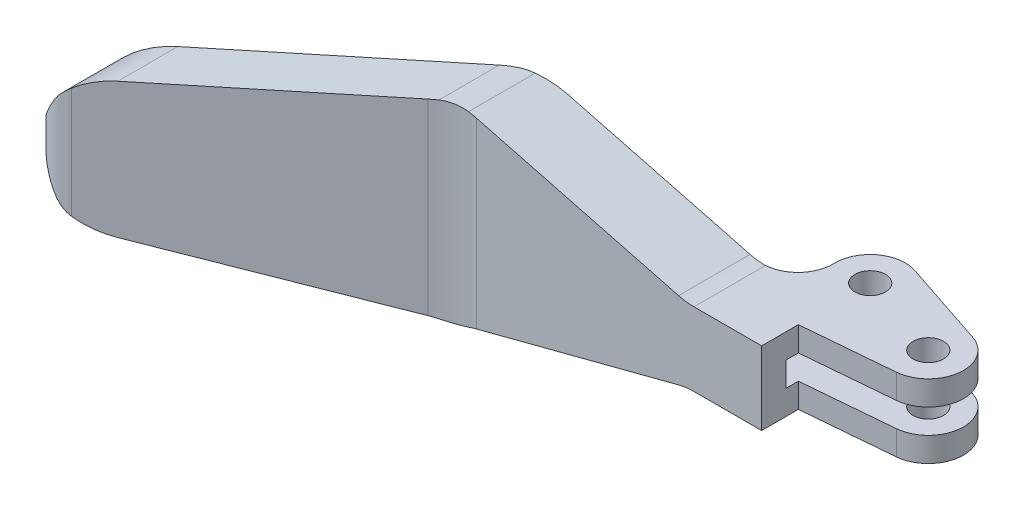
from build123d import *

# Parameters (mm, degrees)
SKETCH2_R               = 1.27
BOSS_EXTRUDE1_DEPTH     = 16.002
CUT_EXTRUDE1_DEPTH      = 60.496550351
CUT_EXTRUDE1_DEPTH_BACK = 60.496550351
SKETCH3_W               = 12.7
SKETCH3_H               = 2.032
FILLET1_R               = 5.08
SKETCH4_W               = 9.906
SKETCH4_H               = 2.032
CUT_EXTRUDE2_DEPTH      = 55.596199244


with BuildPart() as part:
    # Sketch2 → Boss-Extrude1 (new body)
    with BuildSketch(Plane(origin=(0, 0, 0), x_dir=(1, 0, 0), z_dir=(0, 1, 0))):
        with BuildLine():
            Line((-6.309150324, 5.176027743), (0.921622127, 2.771796106))
            ThreePointArc((0.921622127, 2.771796106), (2.901075357, -0.340591799), (0.254581925, -2.909884713))
            Line((0.254581925, -2.909884713), (-7.230772451, -3.564768363))
            Line((-7.230772451, -3.564768363), (-7.230772451, -6.612768363))
            Line((-7.230772451, -6.612768363), (-30.929295079, -6.612768363))
            ThreePointArc((-30.929295079, -6.612768363), (-32.572796015, -6.829139367), (-34.104295079, -7.463507049))
            Line((-34.104295079, -7.463507049), (-52.868054087, -18.296768363))
            ThreePointArc((-52.868054087, -18.296768363), (-54.409974386, -18.499766022), (-55.643817707, -17.553004743))
            Line((-55.643817707, -17.553004743), (-55.770817707, -17.33303429))
            ThreePointArc((-55.770817707, -17.33303429), (-55.973815366, -15.791113991), (-55.027054087, -14.55727067))
            Line((-55.027054087, -14.55727067), (-32.459574962, -1.527930522))
            ThreePointArc((-32.459574962, -1.527930522), (-30.928075898, -0.893562839), (-29.284574962, -0.677191836))
            Line((-29.284574962, -0.677191836), (-13.070569392, -0.677191836))
            ThreePointArc((-13.070569392, -0.677191836), (-10.976943412, 0.206905795), (-10.150670921, 2.3240199))
            ThreePointArc((-10.150670921, 2.3240199), (-9.32439843, 4.441134005), (-7.230772451, 5.325231637))
            ThreePointArc((-7.230772451, 5.325231637), (-6.76396169, 5.287689407), (-6.309150324, 5.176027743))
        make_face()
        with Locations((-7.230772451, 2.404231637)):
            Circle(SKETCH2_R, mode=Mode.SUBTRACT)
        Circle(SKETCH2_R, mode=Mode.SUBTRACT)
    extrude(amount=BOSS_EXTRUDE1_DEPTH)

    # Sketch3 → Cut-Extrude1 (cut, two sides: drawn at the far end of the back side and taken through both)
    with BuildSketch(Plane.XY.offset(6.612768363).offset(-CUT_EXTRUDE1_DEPTH_BACK)):
        with Locations((-0.880772451, 8.001)):
            Rectangle(SKETCH3_W, SKETCH3_H)
        Polygon((2.921, 11.049), (-13.502358791, 11.049), (-32.516795079, 16.002), (-52.868054087, 13.30324349), (-56.043054087, 8.001), (-52.868054087, 2.69875651), (-32.516795079, 0), (-13.502358791, 4.953), (2.921, 4.953), (2.921, -1.60363535), (-57.556427558, -1.60363535), (-57.556427558, 17.60563535), (2.921, 17.60563535), align=None)
    extrude(amount=CUT_EXTRUDE1_DEPTH + CUT_EXTRUDE1_DEPTH_BACK, mode=Mode.SUBTRACT)

    # Fillet1
    fillet1_edges = [part.edges().sort_by_distance(p)[0] for p in [
        (-13.502358791, 4.953, 3.6449801),
    ]]
    fillet(fillet1_edges, radius=FILLET1_R)
    fillet1_2_edges = [part.edges().sort_by_distance(p)[0] for p in [
        (-52.868054087, 13.30324349, 15.803769901),
    ]]
    fillet(fillet1_2_edges, radius=FILLET1_R)
    fillet1_3_edges = [part.edges().sort_by_distance(p)[0] for p in [
        (-32.516795079, 16.002, 4.187686937),
    ]]
    fillet(fillet1_3_edges, radius=FILLET1_R)
    fillet1_4_edges = [part.edges().sort_by_distance(p)[0] for p in [
        (-52.868054087, 2.69875651, 15.803769901),
    ]]
    fillet(fillet1_4_edges, radius=FILLET1_R)
    fillet1_5_edges = [part.edges().sort_by_distance(p)[0] for p in [
        (-32.516795079, 0, 4.187686937),
    ]]
    fillet(fillet1_5_edges, radius=FILLET1_R)
    fillet1_6_edges = [part.edges().sort_by_distance(p)[0] for p in [
        (-13.502358791, 11.049, 3.6449801),
    ]]
    fillet(fillet1_6_edges, radius=FILLET1_R)

    # Sketch4 → Cut-Extrude2 (cut, through all)
    with BuildSketch(Plane(origin=(-7.230772451, 0, 0), x_dir=(0, 0, -1), z_dir=(1, 0, 0))):
        with Locations((0.372231637, 8.001)):
            Rectangle(SKETCH4_W, SKETCH4_H)
    extrude(amount=-CUT_EXTRUDE2_DEPTH, mode=Mode.SUBTRACT)


solid = part.part
